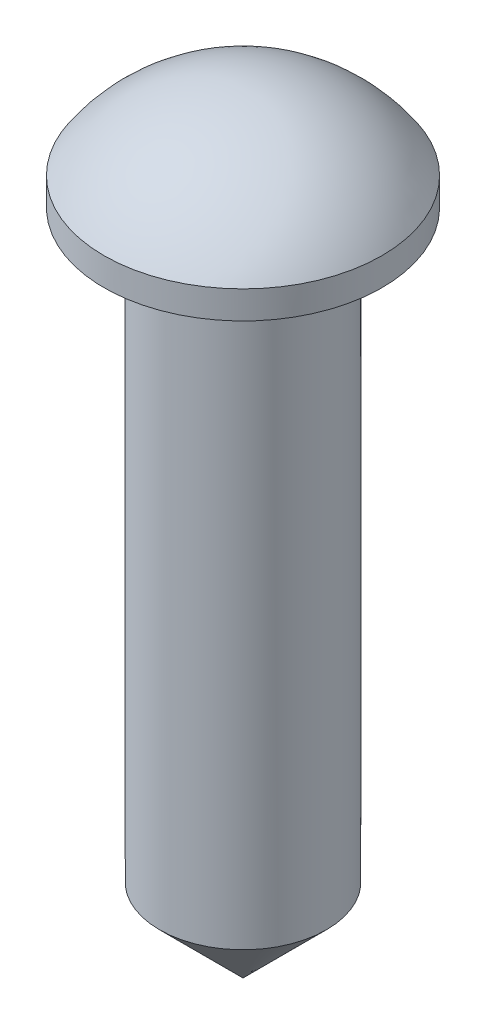
from build123d import *


with BuildPart() as part:
    # Sketch1 → Revolve1 (revolve)
    with BuildSketch(Plane.XY):
        with BuildLine():
            Line((-1.5, -1.841687605), (-1.5, -12.341687605))
            Line((-1.5, -12.341687605), (0, -13.841687605))
            Line((0, -13.841687605), (0, 0))
            ThreePointArc((0, 0), (-1.418637165, -0.356617963), (-2.5, -1.341687605))
            Line((-2.5, -1.341687605), (-2.5, -1.841687605))
            Line((-2.5, -1.841687605), (-1.5, -1.841687605))
        make_face()
    revolve(axis=Axis((0, -13.841687605, 0), (0, 1, 0)))


solid = part.part
